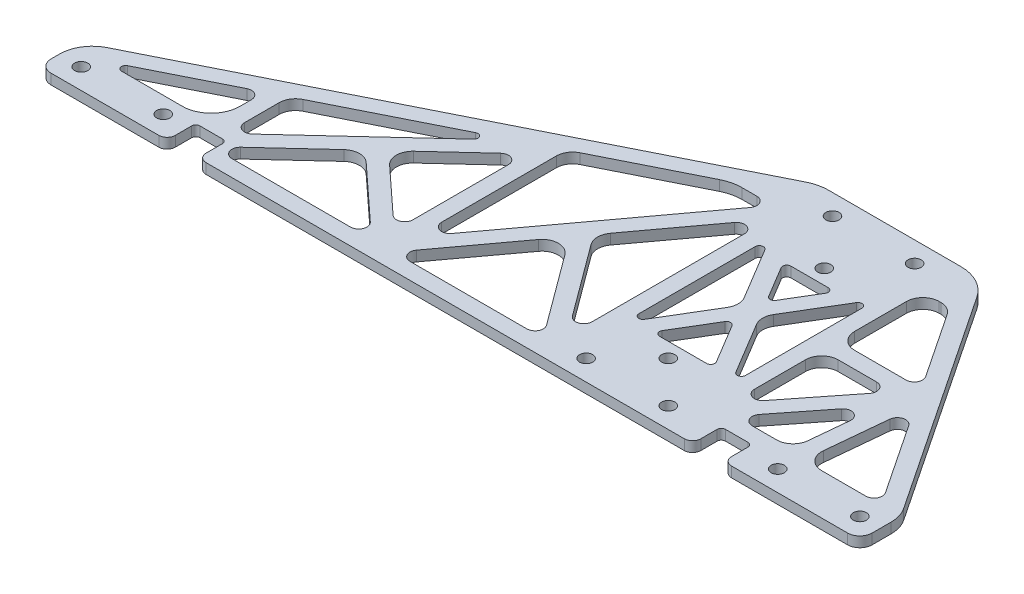
from build123d import *

# Parameters (mm, degrees)
SKETCH1_R           = 2.032
BOSS_EXTRUDE1_DEPTH = 3.175
SKETCH1_3_R         = 2.032
CUT_EXTRUDE2_DEPTH  = 270.126904313
FILLET1_R           = 3.81
FILLET2_R           = 10.16
FILLET3_R           = 12.7
FILLET4_R           = 1.27
FILLET5_R           = 2.54
FILLET6_R           = 5.08
FILLET7_R           = 12.7
FILLET10_R          = 8.89
SKETCH2_W           = 9.525
SKETCH2_H           = 8.89
CUT_EXTRUDE3_DEPTH  = 270.126904313
FILLET8_R           = 1.27
FILLET9_R           = 2.54


with BuildPart() as part:
    # Sketch1 → Boss-Extrude1 (new body)
    with BuildSketch(Plane(origin=(0, 0, 0), x_dir=(1, 0, 0), z_dir=(0, 1, 0))):
        Polygon((0, 0), (254, 0), (254, 12.7), (203.2, 88.9), (152.4, 88.9), (0, 12.7), align=None)
        with Locations((6.773333333, 6.35)):
            Circle(SKETCH1_R, mode=Mode.SUBTRACT)
        with Locations((32.173333333, 6.35)):
            Circle(SKETCH1_R, mode=Mode.SUBTRACT)
        with Locations((222.25, 6.35)):
            Circle(SKETCH1_R, mode=Mode.SUBTRACT)
        with Locations((247.65, 6.35)):
            Circle(SKETCH1_R, mode=Mode.SUBTRACT)
        with Locations((162.983333333, 82.55)):
            Circle(SKETCH1_R, mode=Mode.SUBTRACT)
        with Locations((188.383333333, 82.55)):
            Circle(SKETCH1_R, mode=Mode.SUBTRACT)
    extrude(amount=BOSS_EXTRUDE1_DEPTH)

    # Sketch1<3> → Cut-Extrude2 (cut, through all)
    with BuildSketch(Plane(origin=(0, 0, 0), x_dir=(1, 0, 0), z_dir=(0, 1, 0))):
        Polygon((8.819225326, 11.43), (41.91, 11.43), (41.91, 27.975387337), align=None)
        Polygon((73.025, 27.993892654), (48.195281614, 5.08), (97.854718386, 5.08), align=None)
        Polygon((46.99, 30.515387337), (46.99, 10.88031823), (93.426011301, 53.733392988), align=None)
        Polygon((150.936383508, 76.2), (138.359225326, 76.2), (104.14, 59.090387337), (104.14, 12.79844815), align=None)
        with Locations((188.383333333, 6.35)):
            Circle(SKETCH1_3_R)
        Polygon((104.756949825, 5.08), (150.936383508, 5.08), (127.846666667, 36.362842172), align=None)
        with Locations((162.983333333, 6.35)):
            Circle(SKETCH1_3_R)
        Polygon((99.06, 52.020069107), (76.770281614, 31.450193669), (99.06, 10.88031823), align=None)
        Polygon((223.00729992, 50.03094988), (205.561266507, 76.2), (197.273333333, 76.2), (197.273333333, 50.03094988), align=None)
        Polygon((131.003616492, 40.64), (154.093333333, 9.357157828), (154.093333333, 71.922842172), align=None)
        Polygon((197.273333333, 44.95094988), (197.273333333, 16.802739743), (219.463857142, 44.95094988), align=None)
        Polygon((166.148656896, 23.622), (185.218009771, 23.622), (175.683333333, 39.513127396), align=None)
        Polygon((178.645456896, 44.45), (192.193333333, 21.870205938), (192.193333333, 67.029794062), align=None)
        Polygon((221.333484531, 39.117053196), (201.508910253, 13.97), (218.885586813, 13.97), align=None)
        Polygon((172.721209771, 44.45), (159.173333333, 67.029794062), (159.173333333, 21.870205938), align=None)
        Polygon((223.865972381, 12.7), (247.89459984, 12.7), (226.927485283, 44.150671836), align=None)
        Polygon((183.694009771, 62.738), (167.672656896, 62.738), (175.683333333, 49.386872604), align=None)
        with Locations((175.683333333, 19.05)):
            Circle(SKETCH1_3_R)
        with Locations((175.683333333, 67.31)):
            Circle(SKETCH1_3_R)
    extrude(amount=CUT_EXTRUDE2_DEPTH, mode=Mode.SUBTRACT)

    # Fillet1
    fillet1_edges = [part.edges().sort_by_distance(p)[0] for p in [
        (254, 1.5875, 0),
        (0, 1.5875, 0),
    ]]
    fillet(fillet1_edges, radius=FILLET1_R)

    # Fillet2
    fillet2_edges = [part.edges().sort_by_distance(p)[0] for p in [
        (254, 1.5875, -12.7),
        (0, 1.5875, -12.7),
    ]]
    fillet(fillet2_edges, radius=FILLET2_R)

    # Fillet3
    fillet3_edges = [part.edges().sort_by_distance(p)[0] for p in [
        (203.2, 1.5875, -88.9),
        (152.4, 1.5875, -88.9),
    ]]
    fillet(fillet3_edges, radius=FILLET3_R)

    # Fillet4
    fillet4_edges = [part.edges().sort_by_distance(p)[0] for p in [
        (159.173333333, 1.5875, -67.029794062),
        (192.193333333, 1.5875, -67.029794062),
        (192.193333333, 1.5875, -21.870205938),
        (159.173333333, 1.5875, -21.870205938),
        (183.694009771, 1.5875, -62.738),
        (167.672656896, 1.5875, -62.738),
        (175.683333333, 1.5875, -49.386872604),
        (185.218009771, 1.5875, -23.622),
        (166.148656896, 1.5875, -23.622),
        (175.683333333, 1.5875, -39.513127396),
        (93.426011301, 1.5875, -53.733392988),
        (8.819225326, 1.5875, -11.43),
    ]]
    fillet(fillet4_edges, radius=FILLET4_R)

    # Fillet5
    fillet5_edges = [part.edges().sort_by_distance(p)[0] for p in [
        (223.00729992, 1.5875, -50.03094988),
        (247.89459984, 1.5875, -12.7),
        (226.927485283, 1.5875, -44.150671836),
        (221.333484531, 1.5875, -39.117053196),
        (197.273333333, 1.5875, -16.802739743),
        (219.463857142, 1.5875, -44.95094988),
        (104.14, 1.5875, -12.79844815),
        (99.06, 1.5875, -52.020069107),
        (48.195281614, 1.5875, -5.08),
        (97.854718386, 1.5875, -5.08),
        (99.06, 1.5875, -10.88031823),
        (104.756949825, 1.5875, -5.08),
        (150.936383508, 1.5875, -5.08),
        (154.093333333, 1.5875, -9.357157828),
        (154.093333333, 1.5875, -71.922842172),
        (150.936383508, 1.5875, -76.2),
        (41.91, 1.5875, -27.975387337),
        (46.99, 1.5875, -10.88031823),
        (201.508910253, 1.5875, -13.97),
    ]]
    fillet(fillet5_edges, radius=FILLET5_R)

    # Fillet6
    fillet6_edges = [part.edges().sort_by_distance(p)[0] for p in [
        (172.721209771, 1.5875, -44.45),
        (178.645456896, 1.5875, -44.45),
        (223.865972381, 1.5875, -12.7),
        (197.273333333, 1.5875, -50.03094988),
        (197.273333333, 1.5875, -44.95094988),
        (197.273333333, 1.5875, -76.2),
        (205.561266507, 1.5875, -76.2),
        (73.025, 1.5875, -27.993892654),
        (76.770281614, 1.5875, -31.450193669),
        (104.14, 1.5875, -59.090387337),
        (131.003616492, 1.5875, -40.64),
        (127.846666667, 1.5875, -36.362842172),
        (46.99, 1.5875, -30.515387337),
        (218.885586813, 1.5875, -13.97),
    ]]
    fillet(fillet6_edges, radius=FILLET6_R)

    # Fillet7
    fillet7_edges = [part.edges().sort_by_distance(p)[0] for p in [
        (138.359225326, 1.5875, -76.2),
    ]]
    fillet(fillet7_edges, radius=FILLET7_R)

    # Fillet10
    fillet10_edges = [part.edges().sort_by_distance(p)[0] for p in [
        (41.91, 1.5875, -11.43),
    ]]
    fillet(fillet10_edges, radius=FILLET10_R)

    # Sketch2 → Cut-Extrude3 (cut, through all)
    with BuildSketch(Plane(origin=(0, 3.175, 0), x_dir=(1, 0, 0), z_dir=(0, 1, 0))):
        with Locations((207.01, 4.445)):
            Rectangle(SKETCH2_W, SKETCH2_H)
        with Locations((44.45, 4.445)):
            Rectangle(SKETCH2_W, SKETCH2_H)
    extrude(amount=-CUT_EXTRUDE3_DEPTH, mode=Mode.SUBTRACT)

    # Fillet8
    fillet8_edges = [part.edges().sort_by_distance(p)[0] for p in [
        (211.7725, 1.5875, -8.89),
        (202.2475, 1.5875, -8.89),
        (49.2125, 1.5875, -8.89),
        (39.6875, 1.5875, -8.89),
    ]]
    fillet(fillet8_edges, radius=FILLET8_R)

    # Fillet9
    fillet9_edges = [part.edges().sort_by_distance(p)[0] for p in [
        (49.2125, 1.5875, 0),
        (39.6875, 1.5875, 0),
        (211.7725, 1.5875, 0),
        (202.2475, 1.5875, 0),
    ]]
    fillet(fillet9_edges, radius=FILLET9_R)


solid = part.part
